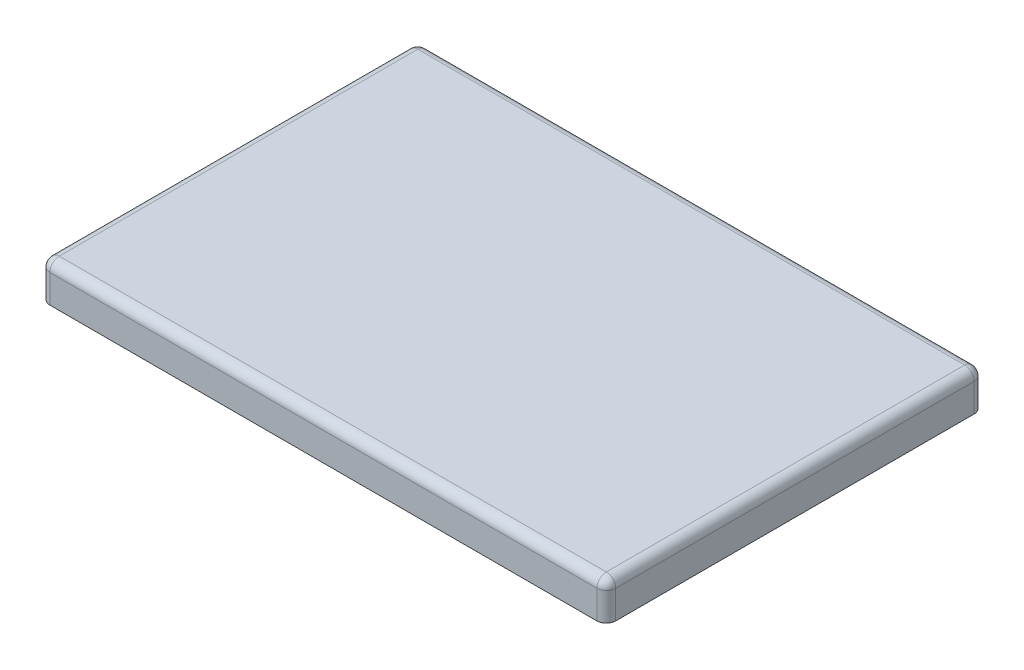
from build123d import *

# Parameters (mm, degrees)
BOSS_EXTRUDE1_DEPTH = 10
SHELL1_T            = -1.25
FILLET1_R           = 2.5
CHAMFER1_SIZE       = 1.25


with BuildPart() as part:
    # Sketch1 → Boss-Extrude1 (new body)
    with BuildSketch(Plane(origin=(0, 0, 0), x_dir=(1, 0, 0), z_dir=(0, 1, 0))):
        with BuildLine():
            Line((-72.5, -50), (72.5, -50))
            ThreePointArc((72.5, -50), (74.267766953, -49.267766953), (75, -47.5))
            Line((75, -47.5), (75, 47.5))
            ThreePointArc((75, 47.5), (74.267766953, 49.267766953), (72.5, 50))
            Line((72.5, 50), (-72.5, 50))
            ThreePointArc((-72.5, 50), (-74.267766953, 49.267766953), (-75, 47.5))
            Line((-75, 47.5), (-75, -47.5))
            ThreePointArc((-75, -47.5), (-74.267766953, -49.267766953), (-72.5, -50))
        make_face()
    extrude(amount=BOSS_EXTRUDE1_DEPTH)

    # Shell1
    shell1_openings = [part.faces().sort_by_distance(p)[0] for p in [
        (0, 0, 0),
    ]]
    offset(amount=SHELL1_T, openings=shell1_openings, kind=Kind.INTERSECTION)

    # Fillet1
    fillet1_edges = [part.edges().sort_by_distance(p)[0] for p in [
        (74.267766953, 10, 49.267766953),
        (75, 10, 0),
        (74.267766953, 10, -49.267766953),
        (0, 10, -50),
        (-74.267766953, 10, -49.267766953),
        (-75, 10, 0),
        (-74.267766953, 10, 49.267766953),
        (0, 10, 50),
    ]]
    fillet(fillet1_edges, radius=FILLET1_R)

    # Chamfer1
    chamfer1_edges = [part.edges().sort_by_distance(p)[0] for p in [
        (-73.383883476, 0, 48.383883476),
        (0, 0, 48.75),
        (73.383883476, 0, 48.383883476),
        (73.75, 0, 0),
        (73.383883476, 0, -48.383883476),
        (0, 0, -48.75),
        (-73.383883476, 0, -48.383883476),
        (-73.75, 0, 0),
    ]]
    chamfer(chamfer1_edges, length=CHAMFER1_SIZE - 0.0001)  # a hair under: the kernel refuses the full size


solid = part.part
